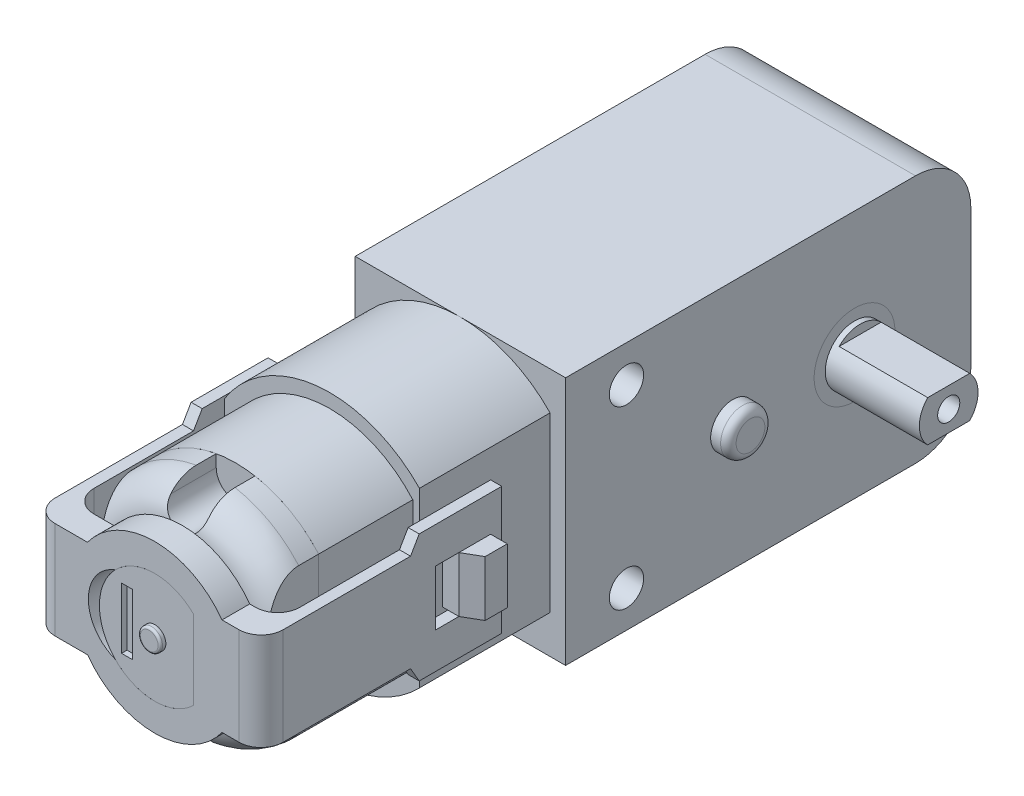
from build123d import *

# Parameters (mm, degrees)
SALIENTE_EXTRUIR1_DEPTH      = 9.5
CROQUIS2_R                   = 1.55
CORTAR_EXTRUIR1_DEPTH        = 29.678432663
CROQUIS3_W                   = 5
CROQUIS3_H                   = 5
CROQUIS3_R                   = 1.55
SALIENTE_EXTRUIR2_DEPTH      = 1.5
CROQUIS4_R                   = 11.25
SALIENTE_EXTRUIR3_DEPTH      = 11.8
CROQUIS6_R                   = 10
SALIENTE_EXTRUIR4_DEPTH      = 8.5
CROQUIS8_W                   = 26.689657694
CROQUIS8_H                   = 29.913961842
CROQUIS8_W_2                 = 17.6
CROQUIS8_H_2                 = 22.5
CORTAR_EXTRUIR2_DEPTH        = 11.8
CORTAR_EXTRUIR3_START        = -69.2
CROQUIS9_W                   = 23.391110728
CROQUIS9_H                   = 27.895352682
CROQUIS9_W_2                 = 15
CROQUIS9_H_2                 = 22.5
CORTAR_EXTRUIR3_DEPTH        = 69.2
CROQUIS10_R                  = 10.61740071
CORTAR_EXTRUIR4_DEPTH        = 2.5
CROQUIS12_R                  = 2.65
SALIENTE_EXTRUIR5_DEPTH      = 0.5
SALIENTE_EXTRUIR6_DEPTH      = 8
CROQUIS14_R                  = 1
CORTAR_EXTRUIR5_DEPTH        = 8
SALIENTE_EXTRUIR7_DEPTH      = 2.5
CORTAR_EXTRUIR7_START        = -7.3
CORTAR_EXTRUIR7_DEPTH        = 4.800007
CROQUIS18_R                  = 2
SALIENTE_EXTRUIR8_DEPTH      = 1.6
REDONDEO1_R                  = 0.7
SALIENTE_EXTRUIR9_DEPTH      = 2.5
CROQUIS20_R                  = 1
CROQUIS20_W                  = 1
CROQUIS20_H                  = 5.5
CORTAR_EXTRUIR8_DEPTH        = 0.5
CROQUIS21_R                  = 1
SALIENTE_EXTRUIR10_DEPTH     = 1
REDONDEO2_R                  = 0.2
CROQUIS23_W                  = 1
CROQUIS23_H                  = 19.23240749
SALIENTE_EXTRUIR11_DEPTH     = 5.75
SALIENTE_EXTRUIR11_2_DEPTH   = 5.75
REDONDEO3_R                  = 2
CROQUIS24_W                  = 31.46759251
CROQUIS24_H                  = 15.614416416
CROQUIS24_W_2                = 2.133974596
CROQUIS24_H_2                = 5
CORTAR_EXTRUIR9_DEPTH        = 1.5
CORTAR_EXTRUIR12_START       = -1.5
CORTAR_EXTRUIR12_OUTLINE_W   = 31.46759251
CORTAR_EXTRUIR12_OUTLINE_H   = 15.614416416
CORTAR_EXTRUIR12_OUTLINE_W_2 = 2.133974596
CORTAR_EXTRUIR12_OUTLINE_H_2 = 5
CORTAR_EXTRUIR12_DEPTH       = 1.5
CORTAR_EXTRUIR12_2_OUTLINE_W = 2.133974596
CORTAR_EXTRUIR12_2_OUTLINE_H = 5
CORTAR_EXTRUIR12_2_DEPTH     = 3
ELIMINAR_START               = -4.4
ELIMINAR_CARA1_DEPTH         = 8.8
ELIMINAR_CARA2_DEPTH         = 8.8


with BuildPart() as part:
    # Croquis1 → Saliente-Extruir1 (new, symmetric)
    with BuildSketch(Plane(origin=(0, 0, 0), x_dir=(0, 0, -1), z_dir=(1, 0, 0))):
        with BuildLine():
            Line((-18.3, 11.25), (13.3, 11.25))
            ThreePointArc((13.3, 11.25), (16.835533906, 9.785533906), (18.3, 6.25))
            Line((18.3, 6.25), (18.3, -6.25))
            ThreePointArc((18.3, -6.25), (16.835533906, -9.785533906), (13.3, -11.25))
            Line((13.3, -11.25), (-18.3, -11.25))
            Line((-18.3, -11.25), (-18.3, 11.25))
        make_face()
    extrude(amount=SALIENTE_EXTRUIR1_DEPTH, both=True)

    # Croquis2 → Cortar-Extruir1 (cut, through all)
    with BuildSketch(Plane(origin=(9.5, 0, 0), x_dir=(0, 0, -1), z_dir=(1, 0, 0))):
        with Locations((-12.8, 7.95)):
            Circle(CROQUIS2_R)
        with Locations(Location((-12.8, -7.95, 0), (0, 0, 180))):
            Circle(CROQUIS2_R)
    extrude(amount=-CORTAR_EXTRUIR1_DEPTH, mode=Mode.SUBTRACT)

    # Croquis3 → Saliente-Extruir2 (add, symmetric)
    with BuildSketch(Plane(origin=(0, 0, 0), x_dir=(0, 0, -1), z_dir=(1, 0, 0))):
        with Locations((20.8, 0)):
            Rectangle(CROQUIS3_W, CROQUIS3_H)
        with Locations((20.8, 0)):
            Circle(CROQUIS3_R, mode=Mode.SUBTRACT)
    extrude(amount=SALIENTE_EXTRUIR2_DEPTH, both=True)

    # Croquis4 → Saliente-Extruir3 (add)
    with BuildSketch(Plane.XY.offset(18.3)):
        with Locations(Location((0, 0, 0), (0, 0, 147.612461467))):
            Circle(CROQUIS4_R)
    extrude(amount=SALIENTE_EXTRUIR3_DEPTH)

    # Croquis8 → Cortar-Extruir2 (cut)
    with BuildSketch(Plane.XY.offset(30.1)):
        Rectangle(CROQUIS8_W, CROQUIS8_H)
        with Locations((-0.7, 0)):
            Rectangle(CROQUIS8_W_2, CROQUIS8_H_2, mode=Mode.SUBTRACT)
    extrude(amount=-CORTAR_EXTRUIR2_DEPTH, mode=Mode.SUBTRACT)

    # Croquis16 → Saliente-Extruir7 (add, symmetric)
    with BuildSketch(Plane(origin=(0, 0, 0), x_dir=(1, 0, 0), z_dir=(0, 1, 0))):
        Polygon((9.6, -26.533617914), (9.6, -25.16759251), (11.1, -25.16759251), (11.1, -27.16759251), (8.1, -28.899643318), (8.1, -27.399643318), align=None)
        Polygon((-11, -26.533617914), (-9.5, -27.399643318), (-9.5, -28.899643318), (-12.5, -27.16759251), (-12.5, -25.16759251), (-11, -25.16759251), align=None)
    extrude(amount=SALIENTE_EXTRUIR7_DEPTH, both=True)

    # Croquis18 → Saliente-Extruir8 (add)
    with BuildSketch(Plane(origin=(9.5, 0, 0), x_dir=(0, 0, -1), z_dir=(1, 0, 0))):
        with Locations((-3.2, 0)):
            Circle(CROQUIS18_R)
    extrude(amount=SALIENTE_EXTRUIR8_DEPTH)

    # Redondeo1
    redondeo1_edges = [part.edges().sort_by_distance(p)[0] for p in [
        (11.1, 0, 5.2),
    ]]
    fillet(redondeo1_edges, radius=REDONDEO1_R)


with BuildPart() as body_2:
    # Croquis6 → Saliente-Extruir4 (new body)
    with BuildSketch(Plane.XY.offset(30.1)):
        Circle(CROQUIS6_R)
    extrude(amount=SALIENTE_EXTRUIR4_DEPTH)


with BuildPart() as body_3:
    # Croquis7 → Revolución1 (revolve)
    with BuildSketch(Plane(origin=(0, 0, 0), x_dir=(0, 0, -1), z_dir=(1, 0, 0))):
        with BuildLine():
            Line((-38.6, 10), (-40.4, 10))
            ThreePointArc((-40.4, 10), (-42.521320344, 9.121320344), (-43.4, 7))
            Line((-43.4, 7), (-43.4, 5))
            Line((-43.4, 5), (-45.9, 5))
            Line((-45.9, 5), (-45.9, 0))
            Line((-45.9, 0), (-38.6, 0))
            Line((-38.6, 0), (-38.6, 10))
        make_face()
    revolve(axis=Axis((0, 0, 38.6), (0, 0, 1)))


with BuildPart() as cortar_extruir3_tool:
    # Croquis9 → Cortar-Extruir3 (new body)
    with BuildSketch(Plane.XY.offset(45.9).offset(CORTAR_EXTRUIR3_START)):
        Rectangle(CROQUIS9_W, CROQUIS9_H)
        Rectangle(CROQUIS9_W_2, CROQUIS9_H_2, mode=Mode.SUBTRACT)
    extrude(amount=CORTAR_EXTRUIR3_DEPTH)


with BuildPart() as body_2_1:
    add(body_2.part)

    # Cortar-Extruir3: cut by cortar_extruir3_tool
    add(cortar_extruir3_tool.part, mode=Mode.SUBTRACT)


with BuildPart() as body_3_1:
    add(body_3.part)

    # Cortar-Extruir3: cut by cortar_extruir3_tool
    add(cortar_extruir3_tool.part, mode=Mode.SUBTRACT)

    # Croquis10 → Cortar-Extruir4 (cut)
    with BuildSketch(Plane.XY.offset(45.9)):
        Circle(CROQUIS10_R)
        with BuildLine():
            Line((3.5, 3.570714214), (3.5, -3.570714214))
            ThreePointArc((3.5, -3.570714214), (-5, 0), (3.5, 3.570714214))
        make_face(mode=Mode.SUBTRACT)
    extrude(amount=-CORTAR_EXTRUIR4_DEPTH, mode=Mode.SUBTRACT)

    # Croquis17 → Cortar-Extruir7 (cut)
    with BuildSketch(Plane.XY.offset(45.9).offset(CORTAR_EXTRUIR7_START)):
        with BuildLine():
            Line((1.75, 10), (1.75, 8.75))
            ThreePointArc((1.75, 8.75), (0, 7), (-1.75, 8.75))
            Line((-1.75, 8.75), (-1.75, 10))
            ThreePointArc((-1.75, 10), (0, 11.75), (1.75, 10))
        make_face()
        with BuildLine():
            Line((1.75, -10), (1.75, -8.75))
            ThreePointArc((1.75, -8.75), (0, -7), (-1.75, -8.75))
            Line((-1.75, -8.75), (-1.75, -10))
            ThreePointArc((-1.75, -10), (0, -11.75), (1.75, -10))
        make_face()
    extrude(amount=CORTAR_EXTRUIR7_DEPTH, mode=Mode.SUBTRACT)

    # Croquis20 → Cortar-Extruir8 (cut)
    with BuildSketch(Plane.XY.offset(45.9)):
        Circle(CROQUIS20_R)
        with Locations((-2.5, 0)):
            Rectangle(CROQUIS20_W, CROQUIS20_H)
    extrude(amount=-CORTAR_EXTRUIR8_DEPTH, mode=Mode.SUBTRACT)


with BuildPart() as body_4:
    # Croquis12 → Saliente-Extruir5 (new body)
    with BuildSketch(Plane(origin=(9.5, 0, 0), x_dir=(0, 0, -1), z_dir=(1, 0, 0))):
        with Locations((7.8, 0)):
            Circle(CROQUIS12_R)
    extrude(amount=SALIENTE_EXTRUIR5_DEPTH)

    # Croquis13 → Saliente-Extruir6 (add)
    with BuildSketch(Plane(origin=(10, 0, 0), x_dir=(0, 0, -1), z_dir=(1, 0, 0))):
        with BuildLine():
            Line((9.697366596, 1.85), (5.902633404, 1.85))
            ThreePointArc((5.902633404, 1.85), (5.15, 0), (5.902633404, -1.85))
            Line((5.902633404, -1.85), (9.697366596, -1.85))
            ThreePointArc((9.697366596, -1.85), (10.254640654, -0.998618676), (10.45, 0))
            ThreePointArc((10.45, 0), (10.254640654, 0.998618676), (9.697366596, 1.85))
        make_face()
    extrude(amount=SALIENTE_EXTRUIR6_DEPTH)

    # Croquis14 → Cortar-Extruir5 (cut)
    with BuildSketch(Plane(origin=(18, 0, 0), x_dir=(0, 0, -1), z_dir=(1, 0, 0))):
        with Locations((7.8, 0)):
            Circle(CROQUIS14_R)
    extrude(amount=-CORTAR_EXTRUIR5_DEPTH, mode=Mode.SUBTRACT)


with BuildPart() as body_5:
    # Croquis19 → Saliente-Extruir9 (new body)
    with BuildSketch(Plane.XY.offset(45.9)):
        with BuildLine():
            Line((-6.073713856, 4.4), (-11, 4.4))
            Line((-11, 4.4), (-11, -4.4))
            Line((-11, -4.4), (-6.073713856, -4.4))
            ThreePointArc((-6.073713856, -4.4), (0, -7.5), (6.073713856, -4.4))
            Line((6.073713856, -4.4), (9.6, -4.4))
            Line((9.6, -4.4), (9.6, 4.4))
            Line((9.6, 4.4), (6.073713856, 4.4))
            ThreePointArc((6.073713856, 4.4), (0, 7.5), (-6.073713856, 4.4))
        make_face()
        with BuildLine():
            Line((3.5, -3.570714214), (3.5, 3.570714214))
            ThreePointArc((3.5, 3.570714214), (-0.0500025, 4.999749969), (-3.570714214, 3.5))
            ThreePointArc((-3.570714214, 3.5), (-6, 0), (-3.570714214, -3.5))
            ThreePointArc((-3.570714214, -3.5), (-0.0500025, -4.999749969), (3.5, -3.570714214))
        make_face(mode=Mode.SUBTRACT)
    extrude(amount=-SALIENTE_EXTRUIR9_DEPTH)


with BuildPart() as body_6:
    # Croquis21 → Saliente-Extruir10 (new body)
    with BuildSketch(Plane.XY.offset(45.4)):
        Circle(CROQUIS21_R)
    extrude(amount=SALIENTE_EXTRUIR10_DEPTH)

    # Redondeo2
    redondeo2_edges = [body_6.edges().sort_by_distance(p)[0] for p in [
        (-1, 0, 46.4),
    ]]
    fillet(redondeo2_edges, radius=REDONDEO2_R)


with BuildPart() as body_7:
    # Croquis23 → Saliente-Extruir11 (new, symmetric)
    with BuildSketch(Plane(origin=(0, 0, 0), x_dir=(1, 0, 0), z_dir=(0, 1, 0))):
        with Locations((-10.5, -33.783796255)):
            Rectangle(CROQUIS23_W, CROQUIS23_H)
    extrude(amount=SALIENTE_EXTRUIR11_DEPTH, both=True)


with BuildPart() as body_8:
    # Croquis23 → Saliente-Extruir11 2 (new, symmetric)
    with BuildSketch(Plane(origin=(0, 0, 0), x_dir=(1, 0, 0), z_dir=(0, 1, 0))):
        with Locations((9.1, -33.783796255)):
            Rectangle(CROQUIS23_W, CROQUIS23_H)
    extrude(amount=SALIENTE_EXTRUIR11_2_DEPTH, both=True)

    # Combinar1: union body 5, body 7
    add(body_5.part)
    add(body_7.part)

    # Redondeo3
    redondeo3_edges = [body_8.edges().sort_by_distance(p)[0] for p in [
        (8.6, 0, 43.4),
        (-11, 0, 45.9),
        (9.6, 0, 45.9),
        (-10, 0, 43.4),
    ]]
    fillet(redondeo3_edges, radius=REDONDEO3_R)


with BuildPart() as cortar_extruir9_tool:
    # Croquis24 → Cortar-Extruir9 (new body)
    # profile 1 of 5: a face of its own
    with BuildSketch(Plane(origin=(9.6, 0, 0), x_dir=(0, 0, -1), z_dir=(1, 0, 0))):
        with Locations((-34.033796255, 0)):
            Rectangle(CROQUIS24_W, CROQUIS24_H)
        Polygon((-43.4, 4.4), (-43.9, 4.4), (-43.9, -4.4), (-43.4, -4.4), (-43.4, -5.75), (-24.16759251, -5.75), (-24.16759251, 5.75), (-43.4, 5.75), align=None, mode=Mode.SUBTRACT)
    # profile 2 of 5: a face of its own
    with BuildSketch(Plane(origin=(9.6, 0, 0), x_dir=(0, 0, -1), z_dir=(1, 0, 0))):
        with Locations((-29.100605212, 0)):
            Rectangle(CROQUIS24_W_2, CROQUIS24_H_2)
    # profile 3 of 5: a face of its own
    with BuildSketch(Plane(origin=(9.6, 0, 0), x_dir=(0, 0, -1), z_dir=(1, 0, 0))):
        Polygon((-32.4, -4.4), (-43.4, -4.4), (-43.4, -5.75), (-31.620577137, -5.75), align=None)
    # profile 4 of 5: a face of its own
    with BuildSketch(Plane(origin=(9.6, 0, 0), x_dir=(0, 0, -1), z_dir=(1, 0, 0))):
        Polygon((-43.4, -4.4), (-43.358040092, 0), (-43.4, 4.4), (-43.9, 4.4), (-43.9, -4.4), align=None)
    # profile 5 of 5: a face of its own
    with BuildSketch(Plane(origin=(9.6, 0, 0), x_dir=(0, 0, -1), z_dir=(1, 0, 0))):
        Polygon((-43.4, 5.75), (-43.4, 4.4), (-32.4, 4.4), (-31.620577137, 5.75), align=None)
    extrude(amount=-CORTAR_EXTRUIR9_DEPTH)


with BuildPart() as part_1:
    add(part.part)

    # Cortar-Extruir9: cut by cortar_extruir9_tool
    add(cortar_extruir9_tool.part, mode=Mode.SUBTRACT)

    # Cortar-Extruir12 2 outline → Cortar-Extruir12 2 (cut)
    with BuildSketch(Plane.ZY.offset(11).offset(CORTAR_EXTRUIR12_START)):
        with Locations((29.100605212, 0)):
            Rectangle(CORTAR_EXTRUIR12_2_OUTLINE_W, CORTAR_EXTRUIR12_2_OUTLINE_H)
    extrude(amount=CORTAR_EXTRUIR12_2_DEPTH, mode=Mode.SUBTRACT)


with BuildPart() as body_8_1:
    add(body_8.part)

    # Cortar-Extruir9: cut by cortar_extruir9_tool
    add(cortar_extruir9_tool.part, mode=Mode.SUBTRACT)

    # Cortar-Extruir12: read off the stored shape, not the designer's step
    # Cortar-Extruir12 outline → Cortar-Extruir12 (cut)
    # profile 1 of 2: a face of its own
    with BuildSketch(Plane.ZY.offset(11).offset(CORTAR_EXTRUIR12_START)):
        with Locations((34.033796255, 0)):
            Rectangle(CORTAR_EXTRUIR12_OUTLINE_W, CORTAR_EXTRUIR12_OUTLINE_H)
        Polygon((32.4, -4.4), (31.620577137, -5.75), (24.670652325, -5.75), (24.16759251, 0), (24.670652325, 5.75), (31.620577137, 5.75), (32.4, 4.4), (43.9, 4.4), (43.9, -4.4), align=None, mode=Mode.SUBTRACT)
    # profile 2 of 2: a face of its own
    with BuildSketch(Plane.ZY.offset(11).offset(CORTAR_EXTRUIR12_START)):
        with Locations((29.100605212, 0)):
            Rectangle(CORTAR_EXTRUIR12_OUTLINE_W_2, CORTAR_EXTRUIR12_OUTLINE_H_2)
    extrude(amount=CORTAR_EXTRUIR12_DEPTH, mode=Mode.SUBTRACT)

    # Eliminar cara1: read off the stored shape, not the designer's step
    # Eliminar cara1 outline → Eliminar cara1 (add)
    with BuildSketch(Plane(origin=(0, 0, 0), x_dir=(1, 0, 0), z_dir=(0, 1, 0)).offset(ELIMINAR_START)):
        with BuildLine():
            Line((6.073713856, -45.9), (7.6, -45.9))
            ThreePointArc((7.6, -45.9), (9.014213562, -45.314213562), (9.6, -43.9))
            Line((9.6, -43.9), (9.6, -32.4))
            Line((9.6, -32.4), (8.6, -32.4))
            Line((8.6, -32.4), (8.6, -41.4))
            ThreePointArc((8.6, -41.4), (8.014213562, -42.814213562), (6.6, -43.4))
            Line((6.6, -43.4), (6.073713856, -43.4))
            Line((6.073713856, -43.4), (6.073713856, -45.9))
        make_face()
    extrude(amount=ELIMINAR_CARA1_DEPTH)

    # Eliminar cara2: read off the stored shape, not the designer's step
    # Eliminar cara2 outline → Eliminar cara2 (add)
    with BuildSketch(Plane(origin=(0, 0, 0), x_dir=(1, 0, 0), z_dir=(0, 1, 0)).offset(ELIMINAR_START)):
        with BuildLine():
            ThreePointArc((-11, -43.9), (-10.58113883, -45.124744871), (-9.5, -45.836491673))
            Line((-9.5, -45.836491673), (-9.5, -43.9))
            Line((-9.5, -43.9), (-11, -43.9))
        make_face()
    extrude(amount=ELIMINAR_CARA2_DEPTH)


solid = Compound([body_2_1.part, body_3_1.part, body_4.part, body_6.part, part_1.part, body_8_1.part])
